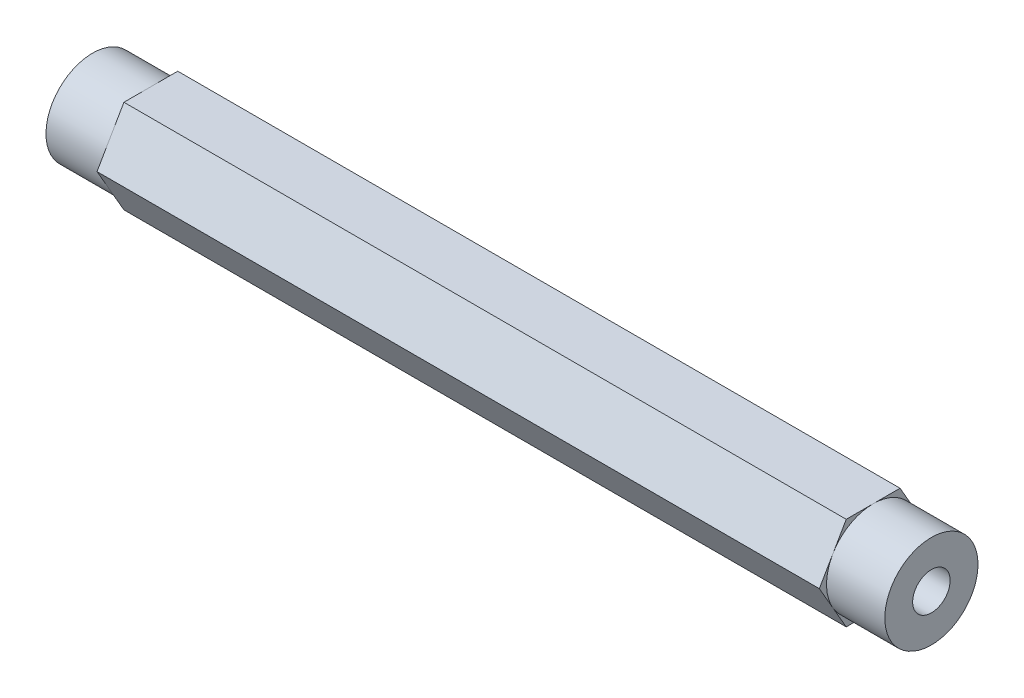
from build123d import *

# Parameters (mm, degrees)
BOSS_EXTRUDE1_DEPTH                   = 57.15
SKETCH3_R                             = 8.89
SKETCH3_R_2                           = 6.35
CUT_EXTRUDE_THIN1_DEPTH               = 7.9375
F_1_4_20_TAPPED_HOLE1_D               = 5.1054
F_1_4_20_TAPPED_HOLE1_DEPTH           = 16.51
F_1_4_20_TAPPED_HOLE1_TIP             = 1.533816902
F_1_4_20_TAPPED_HOLE1_ON_FACE_2_D     = 5.1054
F_1_4_20_TAPPED_HOLE1_ON_FACE_2_DEPTH = 16.51
F_1_4_20_TAPPED_HOLE1_ON_FACE_2_TIP   = 1.533816902


with BuildPart() as part:
    # Sketch2 → Boss-Extrude1 (new, symmetric)
    with BuildSketch(Plane(origin=(0, 0, 0), x_dir=(0, 0, -1), z_dir=(1, 0, 0))):
        Polygon((7.332348419, 0), (3.666174209, 6.35), (-3.666174209, 6.35), (-7.332348419, 0), (-3.666174209, -6.35), (3.666174209, -6.35), align=None)
    extrude(amount=BOSS_EXTRUDE1_DEPTH, both=True)

    # Sketch3 → Cut-Extrude-Thin1 (cut)
    with BuildSketch(Plane(origin=(57.15, 0, 0), x_dir=(0, 0, -1), z_dir=(1, 0, 0))):
        Circle(SKETCH3_R)
        Circle(SKETCH3_R_2, mode=Mode.SUBTRACT)
    cut_extrude_thin1 = extrude(amount=-CUT_EXTRUDE_THIN1_DEPTH, mode=Mode.SUBTRACT)

    # Mirror1: Cut-Extrude-Thin1 across plane
    add(cut_extrude_thin1.mirror(Plane(origin=(0, 0, 0), x_dir=(0, 0, 1), z_dir=(1, 0, 0))), mode=Mode.SUBTRACT)

    # 1/4-20 Tapped Hole1
    with Locations(Plane(origin=(57.15, 0, 0), x_dir=(0, 0, 1), z_dir=(1, 0, 0))):
        with Locations((0, 0)):
            Hole(F_1_4_20_TAPPED_HOLE1_D / 2, depth=F_1_4_20_TAPPED_HOLE1_DEPTH)
            with Locations((0, 0, -(F_1_4_20_TAPPED_HOLE1_DEPTH + F_1_4_20_TAPPED_HOLE1_TIP / 2))):  # 118° drill point
                Cone(0, F_1_4_20_TAPPED_HOLE1_D / 2, F_1_4_20_TAPPED_HOLE1_TIP, mode=Mode.SUBTRACT)

    # 1/4-20 Tapped Hole1 on face 2
    with Locations(Plane(origin=(-57.15, 0, 0), x_dir=(0, 0, -1), z_dir=(-1, 0, 0))):
        with Locations((0, 0)):
            Hole(F_1_4_20_TAPPED_HOLE1_ON_FACE_2_D / 2, depth=F_1_4_20_TAPPED_HOLE1_ON_FACE_2_DEPTH)
            with Locations((0, 0, -(F_1_4_20_TAPPED_HOLE1_ON_FACE_2_DEPTH + F_1_4_20_TAPPED_HOLE1_ON_FACE_2_TIP / 2))):  # 118° drill point
                Cone(0, F_1_4_20_TAPPED_HOLE1_ON_FACE_2_D / 2, F_1_4_20_TAPPED_HOLE1_ON_FACE_2_TIP, mode=Mode.SUBTRACT)


solid = part.part
